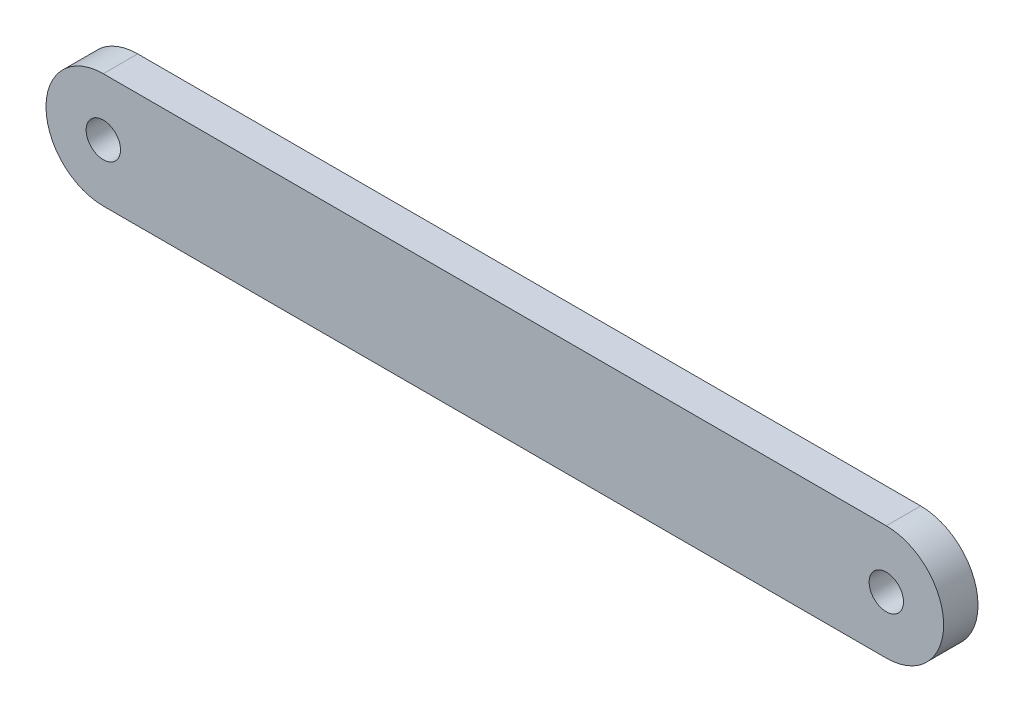
from build123d import *

# Parameters (mm, degrees)
SKETCH_1_R      = 0.75
EXTRUDE_1_DEPTH = 0.75


with BuildPart() as part:
    # 草圖1 → 填料-伸長1 (new, symmetric)
    with BuildSketch(Plane.XY):
        with BuildLine():
            Line((-17.08, 2.5), (17.08, 2.5))
            ThreePointArc((17.08, 2.5), (19.58, 0), (17.08, -2.5))
            Line((17.08, -2.5), (-17.08, -2.5))
            ThreePointArc((-17.08, -2.5), (-19.58, 0), (-17.08, 2.5))
        make_face()
        with Locations((-17.08, 0)):
            Circle(SKETCH_1_R, mode=Mode.SUBTRACT)
        with Locations((17.08, 0)):
            Circle(SKETCH_1_R, mode=Mode.SUBTRACT)
    extrude(amount=EXTRUDE_1_DEPTH, both=True)


solid = part.part
